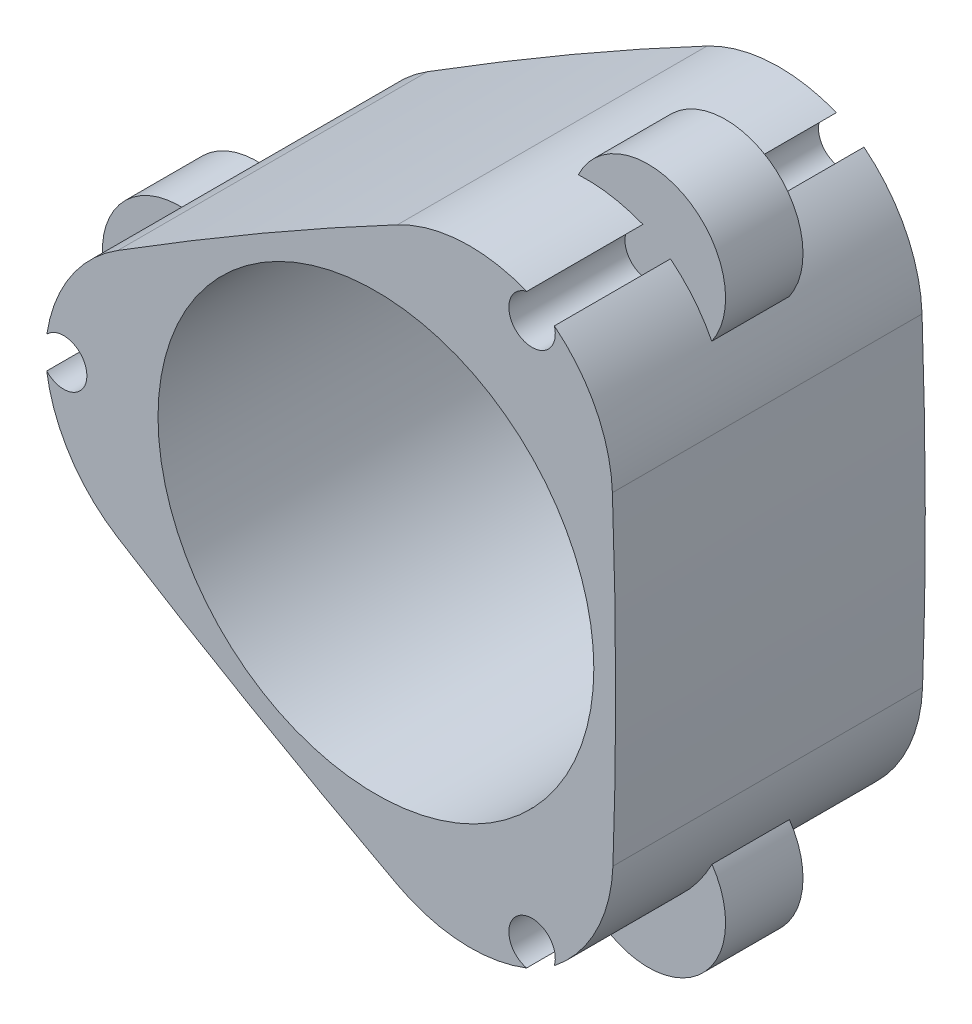
from build123d import *

# Parameters (mm, degrees)
SKETCH1_R               = 14.075
BOSS_EXTRUDE1_DEPTH     = 20
FILLET2_R               = 10
CIRPATTERN2_DEPTH       = 20
CUT_EXTRUDE1_DEPTH      = 36.236736823
CUT_EXTRUDE1_DEPTH_BACK = 36.236736823
SKETCH2_R               = 1.5
SKETCH3_R               = 5
BOSS_EXTRUDE2_DEPTH     = 2.5


# Read off the part's stored shape, not the designer's step: CirPattern2
with BuildPart() as part:
    # Sketch1 → Boss-Extrude1 (new body)
    with BuildSketch(Plane.XY):
        with BuildLine():
            ThreePointArc((15.07572539, 15.156517087), (10.68875, 18.513458069), (5.588066136, 20.634219712))
            add(Edge.make_bspline(
                [(-20.663791525, 5.477702624), (-6.455161962, 14.620684981), (5.588066136, 20.634219712)],
                knots=[0, 0, 0, 1, 1, 1], degree=2))
            ThreePointArc((-20.663791525, 5.477702624), (-21.3775, 0), (-20.663791525, -5.477702624))
            add(Edge.make_bspline(
                [(5.588066136, -20.634219712), (-9.434303633, -12.900676735), (-20.663791525, -5.477702624)],
                knots=[0, 0, 0, 1, 1, 1], degree=2))
            ThreePointArc((5.588066136, -20.634219712), (10.68875, -18.513458069), (15.07572539, -15.156517087))
            add(Edge.make_bspline(
                [(15.07572539, 15.156517087), (15.889465595, -1.720008246), (15.07572539, -15.156517087)],
                knots=[0, 0, 0, 1, 1, 1], degree=2))
        make_face()
        Circle(SKETCH1_R, mode=Mode.SUBTRACT)
    extrude(amount=BOSS_EXTRUDE1_DEPTH)

    # Fillet2
    # the kernel refuses this fillet: 10 mm, written as the material it takes off along each edge
    with BuildSketch(Plane(origin=(-20.663791525, 5.477702624, 0), x_dir=(0.8442926206452175, 0.535882422480931, 0), z_dir=(0, 0, 1))) as fillet2_piece_1:
        with BuildLine():
            CenterArc((4.663228268, -9.99979423), FILLET2_R, 89.632438943, 60.311708344)
            Line((-3.992147587, -4.991354472), (-4.165255104, -4.891185677))
            ThreePointArc((-4.165255104, -4.891185677), (-2.339855889, -2.220716027), (-0.135758458, 0.146866065))
            Line((-0.135758458, 0.146866065), (-0.001245228, 0.199996123))
            ThreePointArc((-0.001245228, 0.199996123), (2.363679869, 0.207468059), (4.728662356, 0.199995885))
            Line((4.728662356, 0.199995885), (4.727379335, 0))
        make_face()
    extrude(amount=20, mode=Mode.SUBTRACT)
    with BuildSketch(Plane(origin=(-20.663791525, -5.477702624, 0), x_dir=(-0.11054249856240242, 0.9938713981253215, 0), z_dir=(0, 0, 1))) as fillet2_piece_2:
        with BuildLine():
            CenterArc((4.841664479, -9.890151004), FILLET2_R, 81.49970425, 59.972427812)
            Line((-2.981388332, -3.661198868), (-3.137849388, -3.536619825))
            ThreePointArc((-3.137849388, -3.536619825), (-1.656048683, -1.695980181), (-0.153629227, 0.128054913))
            Line((-0.153629227, 0.128054913), (-0.029562903, 0.19780302))
            ThreePointArc((-0.029562903, 0.19780302), (3.159904821, 0.434829692), (6.349372545, 0.19780302))
            Line((6.349372545, 0.19780302), (6.319809642, 0))
        make_face()
    extrude(amount=20, mode=Mode.SUBTRACT)

    # CirPattern2 outline → CirPattern2 (cut)
    with BuildSketch(Plane.XY):
        with BuildLine():
            add(Edge.make_bspline(
                [(5.588066136, 20.634219712), (3.520088132, 19.601618033), (1.388262549, 18.476743556)],
                knots=[0, 0, 0, 0.171712932, 0.171712932, 0.171712932], degree=2))
            ThreePointArc((1.388262549, 18.476743556), (6.013402902, 19.632371585), (10.648001522, 18.515279353))
            ThreePointArc((10.648001522, 18.515279353), (13.959170177, 15.045625026), (15.27399868, 10.43329752))
            add(Edge.make_bspline(
                [(15.27399868, 10.43329752), (15.191267831, 12.760230261), (15.07572539, 15.156517087)],
                knots=[0.858010652, 0.858010652, 0.858010652, 1, 1, 1], degree=2))
            ThreePointArc((15.07572539, 15.156517087), (10.68875, 18.513458069), (5.588066136, 20.634219712))
        make_face()
        with BuildLine():
            add(Edge.make_bspline(
                [(15.07572539, -15.156517087), (15.215455106, -12.849294762), (15.307198024, -10.440642412)],
                knots=[0, 0, 0, 0.171712932, 0.171712932, 0.171712932], degree=2))
            ThreePointArc((15.307198024, -10.440642412), (13.995431078, -15.023945468), (10.710701517, -18.479079494))
            ThreePointArc((10.710701517, -18.479079494), (6.0503084, -19.611808503), (1.398501358, -18.444319635))
            add(Edge.make_bspline(
                [(1.398501358, -18.444319635), (3.455049649, -19.536138988), (5.588066136, -20.634219712)],
                knots=[0.858010652, 0.858010652, 0.858010652, 1, 1, 1], degree=2))
            ThreePointArc((5.588066136, -20.634219712), (10.68875, -18.513458069), (15.07572539, -15.156517087))
        make_face()
    extrude(amount=CIRPATTERN2_DEPTH, mode=Mode.SUBTRACT)

    # Sketch2 → Cut-Extrude1 (cut, two sides: drawn at the far end of the back side and taken through both)
    with BuildSketch(Plane.XY.offset(20).offset(-CUT_EXTRUDE1_DEPTH_BACK)):
        with Locations((10.084522584, -17.466905485)):
            Circle(SKETCH2_R)
        with Locations((10.084522584, 17.466905485)):
            Circle(SKETCH2_R)
        with Locations((-20.169045167, 0)):
            Circle(SKETCH2_R)
    extrude(amount=CUT_EXTRUDE1_DEPTH + CUT_EXTRUDE1_DEPTH_BACK, mode=Mode.SUBTRACT)

    # Sketch3 → Boss-Extrude2 (add, symmetric)
    with BuildSketch(Plane.XY.offset(10)):
        with Locations((-20.169045167, 0)):
            Circle(SKETCH3_R)
        with Locations((10.084522584, 17.466905485)):
            Circle(SKETCH3_R)
        with Locations((10.084522584, -17.466905485)):
            Circle(SKETCH3_R)
    extrude(amount=BOSS_EXTRUDE2_DEPTH, both=True)


solid = part.part
